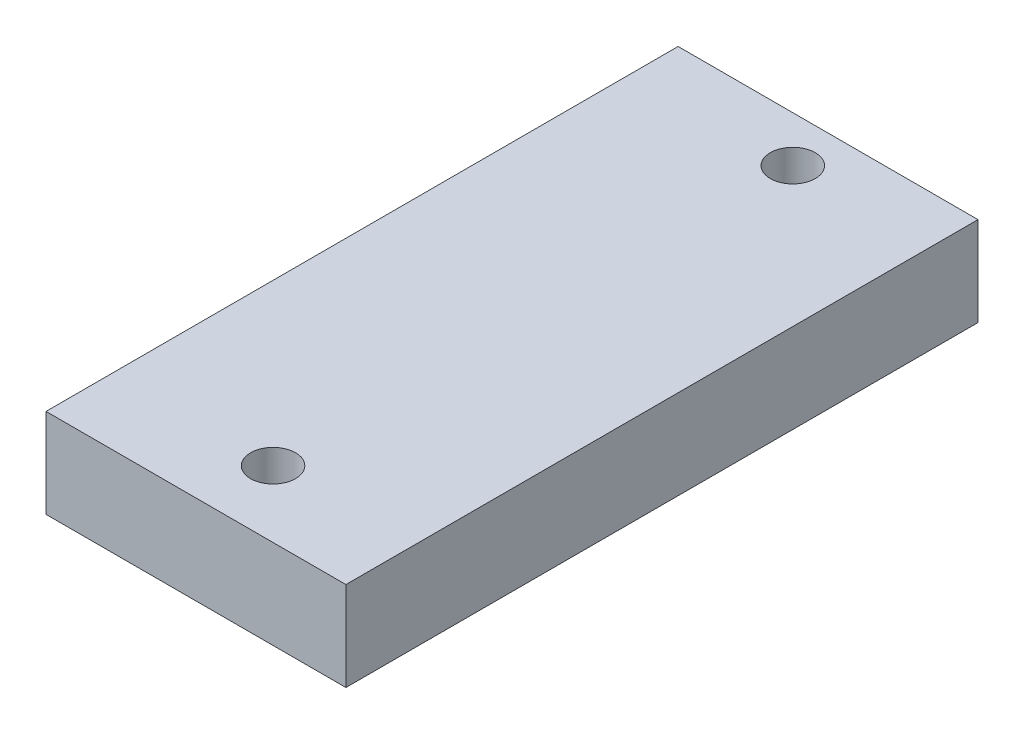
from build123d import *

# Parameters (mm, degrees)
SKETCH1_W           = 21.35
SKETCH1_H           = 45
BOSS_EXTRUDE1_DEPTH = 6.35
SKETCH2_R           = 1.6
CUT_EXTRUDE1_DEPTH  = 10
SKETCH3_R           = 1.6
CUT_EXTRUDE2_DEPTH  = 10


with BuildPart() as part:
    # Sketch1 → Boss-Extrude1 (new body)
    with BuildSketch(Plane(origin=(0, 0, 0), x_dir=(1, 0, 0), z_dir=(0, 1, 0))):
        with Locations((10.675, 22.5)):
            Rectangle(SKETCH1_W, SKETCH1_H)
    extrude(amount=BOSS_EXTRUDE1_DEPTH)

    # Sketch2 → Cut-Extrude1 (cut)
    with BuildSketch(Plane(origin=(0, 6.35, 0), x_dir=(1, 0, 0), z_dir=(0, 1, 0))):
        with Locations((11.429958365, 4.735105989)):
            Circle(SKETCH2_R)
    extrude(amount=-CUT_EXTRUDE1_DEPTH, mode=Mode.SUBTRACT)

    # Sketch3 → Cut-Extrude2 (cut)
    with BuildSketch(Plane(origin=(0, 6.35, 0), x_dir=(1, 0, 0), z_dir=(0, 1, 0))):
        with Locations((11.429958365, 41.735105989)):
            Circle(SKETCH3_R)
    extrude(amount=-CUT_EXTRUDE2_DEPTH, mode=Mode.SUBTRACT)


solid = part.part
